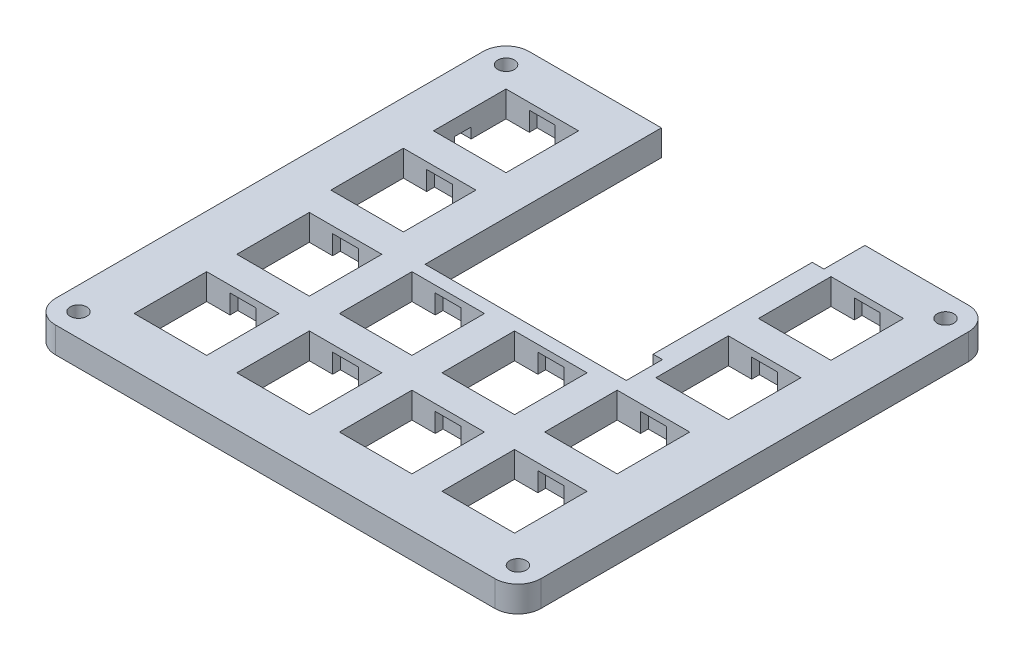
from build123d import *

# Parameters (mm, degrees)
SKETCH2_R           = 1.6
SKETCH2_W           = 14
SKETCH2_H           = 14
BOSS_EXTRUDE1_DEPTH = 5
SKETCH3_W           = 7.855382857
SKETCH3_H           = 3.2
SKETCH3_W_2         = 7.842617143
CUT_EXTRUDE1_DEPTH  = 2
SKETCH4_W           = 5
SKETCH4_H           = 1.5
CUT_EXTRUDE2_DEPTH  = 3.7


with BuildPart() as part:
    # Sketch2 → Boss-Extrude1 (new body)
    with BuildSketch(Plane(origin=(0, 0, 0), x_dir=(1, 0, 0), z_dir=(0, 1, 0))):
        with BuildLine():
            Line((-46.858540632, 41.275), (-46.858540632, -41.275))
            ThreePointArc((-46.858540632, -41.275), (-45.557936393, -44.414936393), (-42.418, -45.715540632))
            Line((-42.418, -45.715540632), (42.418, -45.715540632))
            ThreePointArc((42.418, -45.715540632), (45.557936393, -44.414936393), (46.858540632, -41.275))
            Line((46.858540632, -41.275), (46.858540632, 41.275))
            ThreePointArc((46.858540632, 41.275), (45.557936393, 44.414936393), (42.418, 45.715540632))
            Line((42.418, 45.715540632), (22.418, 45.715540632))
            Line((22.418, 45.715540632), (22.418, 37.797317828))
            Line((22.418, 37.797317828), (20.16872062, 37.797317828))
            Line((20.16872062, 37.797317828), (20.16872062, 7.075))
            Line((20.16872062, 7.075), (21.96872062, 7.075))
            Line((21.96872062, 7.075), (21.96872062, 0.094907102))
            Line((21.96872062, 0.094907102), (-16.875382857, 0.094907102))
            Line((-16.875382857, 0.094907102), (-16.875382857, 45.715540632))
            Line((-16.875382857, 45.715540632), (-42.418, 45.715540632))
            ThreePointArc((-42.418, 45.715540632), (-45.557936393, 44.414936393), (-46.858540632, 41.275))
        make_face()
        with Locations((-42.418, -41.275)):
            Circle(SKETCH2_R, mode=Mode.SUBTRACT)
        with Locations((-29.724382857, -29.217092898)):
            Rectangle(SKETCH2_W, SKETCH2_H, mode=Mode.SUBTRACT)
        with Locations((-9.912382857, -29.217092898)):
            Rectangle(SKETCH2_W, SKETCH2_H, mode=Mode.SUBTRACT)
        with Locations((-29.724382857, -9.405092898)):
            Rectangle(SKETCH2_W, SKETCH2_H, mode=Mode.SUBTRACT)
        with Locations((-9.912382857, -9.405092898)):
            Rectangle(SKETCH2_W, SKETCH2_H, mode=Mode.SUBTRACT)
        with Locations((9.899617143, -29.217092898)):
            Rectangle(SKETCH2_W, SKETCH2_H, mode=Mode.SUBTRACT)
        with Locations((42.418, -41.275)):
            Circle(SKETCH2_R, mode=Mode.SUBTRACT)
        with Locations((29.711617143, -29.217092898)):
            Rectangle(SKETCH2_W, SKETCH2_H, mode=Mode.SUBTRACT)
        with Locations((9.899617143, -9.405092898)):
            Rectangle(SKETCH2_W, SKETCH2_H, mode=Mode.SUBTRACT)
        with Locations((29.711617143, -9.405092898)):
            Rectangle(SKETCH2_W, SKETCH2_H, mode=Mode.SUBTRACT)
        with Locations((-31.375382857, 10.406907102)):
            Rectangle(SKETCH2_W, SKETCH2_H, mode=Mode.SUBTRACT)
        with Locations((-31.375382857, 30.218907102)):
            Rectangle(SKETCH2_W, SKETCH2_H, mode=Mode.SUBTRACT)
        with Locations((-42.418, 41.275)):
            Circle(SKETCH2_R, mode=Mode.SUBTRACT)
        with Locations((31.362617143, 10.406907102)):
            Rectangle(SKETCH2_W, SKETCH2_H, mode=Mode.SUBTRACT)
        with Locations((31.362617143, 30.218907102)):
            Rectangle(SKETCH2_W, SKETCH2_H, mode=Mode.SUBTRACT)
        with Locations((42.418, 41.275)):
            Circle(SKETCH2_R, mode=Mode.SUBTRACT)
    extrude(amount=BOSS_EXTRUDE1_DEPTH)

    # Sketch3 → Cut-Extrude1 (cut)
    with BuildSketch(Plane.XZ):
        with Locations((42.290308572, -28.892)):
            Rectangle(SKETCH3_W, SKETCH3_H)
        with Locations((-42.296691429, -28.892)):
            Rectangle(SKETCH3_W_2, SKETCH3_H)
    extrude(amount=-CUT_EXTRUDE1_DEPTH, mode=Mode.SUBTRACT)

    # Sketch4 → Cut-Extrude2 (cut)
    with BuildSketch(Plane.XZ):
        with Locations((31.362617143, -37.968907102)):
            Rectangle(SKETCH4_W, SKETCH4_H)
        with Locations((31.362617143, -22.468907102)):
            Rectangle(SKETCH4_W, SKETCH4_H)
        with Locations((31.362617143, -18.156907102)):
            Rectangle(SKETCH4_W, SKETCH4_H)
        with Locations((31.362617143, -2.656907102)):
            Rectangle(SKETCH4_W, SKETCH4_H)
        with Locations((29.711617143, 1.655092898)):
            Rectangle(SKETCH4_W, SKETCH4_H)
        with Locations((29.711617143, 17.155092898)):
            Rectangle(SKETCH4_W, SKETCH4_H)
        with Locations((29.711617143, 21.467092898)):
            Rectangle(SKETCH4_W, SKETCH4_H)
        with Locations((29.711617143, 36.967092898)):
            Rectangle(SKETCH4_W, SKETCH4_H)
        with Locations((9.899617143, 1.655092898)):
            Rectangle(SKETCH4_W, SKETCH4_H)
        with Locations((9.899617143, 17.155092898)):
            Rectangle(SKETCH4_W, SKETCH4_H)
        with Locations((9.899617143, 21.467092898)):
            Rectangle(SKETCH4_W, SKETCH4_H)
        with Locations((9.899617143, 36.967092898)):
            Rectangle(SKETCH4_W, SKETCH4_H)
        with Locations((-9.912382857, 1.655092898)):
            Rectangle(SKETCH4_W, SKETCH4_H)
        with Locations((-9.912382857, 17.155092898)):
            Rectangle(SKETCH4_W, SKETCH4_H)
        with Locations((-9.912382857, 21.467092898)):
            Rectangle(SKETCH4_W, SKETCH4_H)
        with Locations((-9.912382857, 36.967092898)):
            Rectangle(SKETCH4_W, SKETCH4_H)
        with Locations((-31.375382857, -37.968907102)):
            Rectangle(SKETCH4_W, SKETCH4_H)
        with Locations((-31.375382857, -22.468907102)):
            Rectangle(SKETCH4_W, SKETCH4_H)
        with Locations((-31.375382857, -18.156907102)):
            Rectangle(SKETCH4_W, SKETCH4_H)
        with Locations((-31.375382857, -2.656907102)):
            Rectangle(SKETCH4_W, SKETCH4_H)
        with Locations((-29.724382857, 1.655092898)):
            Rectangle(SKETCH4_W, SKETCH4_H)
        with Locations((-29.724382857, 17.155092898)):
            Rectangle(SKETCH4_W, SKETCH4_H)
        with Locations((-29.724382857, 21.467092898)):
            Rectangle(SKETCH4_W, SKETCH4_H)
        with Locations((-29.724382857, 36.967092898)):
            Rectangle(SKETCH4_W, SKETCH4_H)
    extrude(amount=-CUT_EXTRUDE2_DEPTH, mode=Mode.SUBTRACT)


solid = part.part
